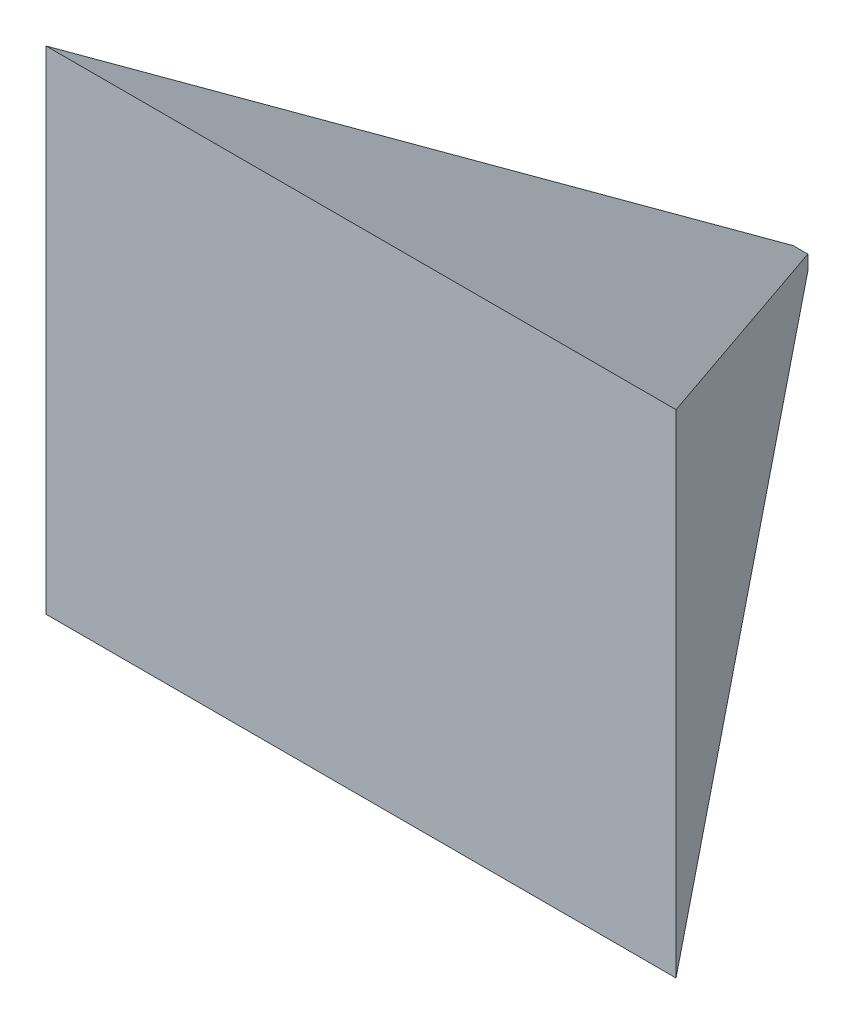
from build123d import *


with BuildPart() as part:
    # Sketch1 → Loft1 section 0
    with BuildSketch(Plane.XY):
        with BuildLine():
            Line((-5, 5), (5, 5))
            Line((5, 5), (5, -5))
            Line((5, -5), (-5, -5))
            Line((-5, -5), (-5, 5))
        make_face()
    # Sketch2 → Loft1 section 1
    with BuildSketch(Plane.XY.offset(300)):
        with BuildLine():
            Line((-215, 168), (215, 168))
            Line((215, 168), (215, -168))
            Line((215, -168), (-215, -168))
            Line((-215, -168), (-215, 168))
        make_face()
    loft()


solid = part.part
